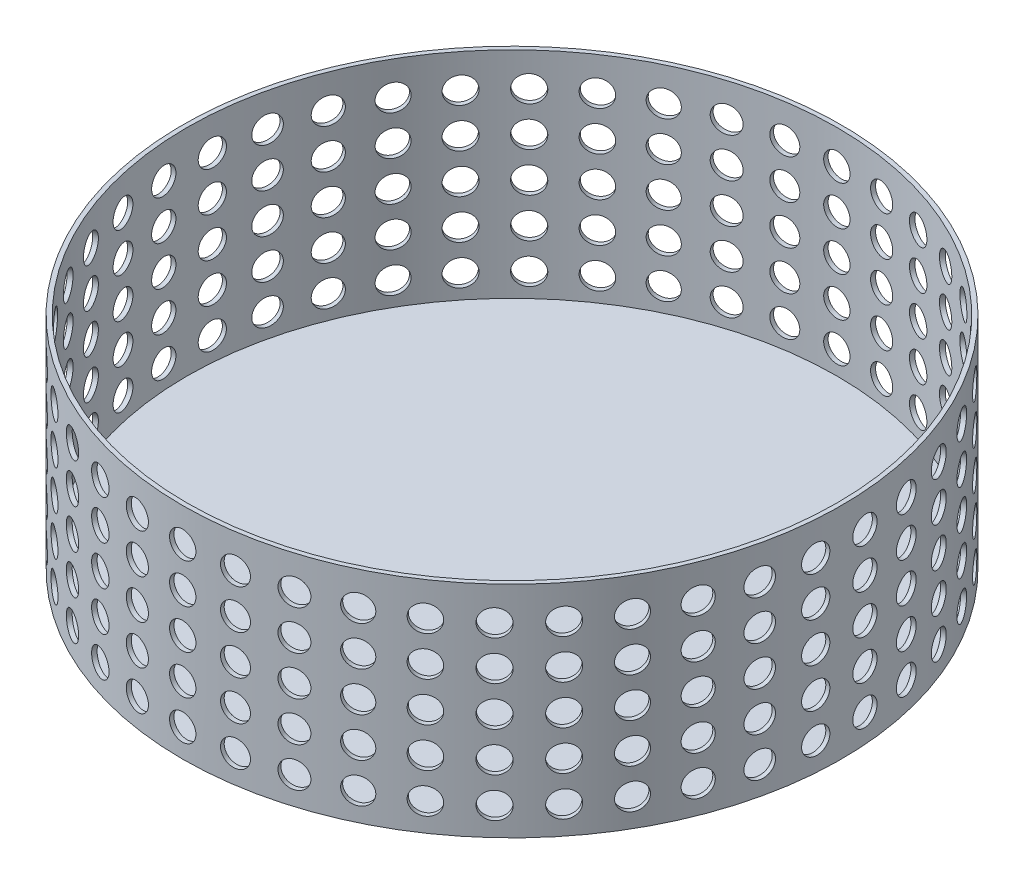
from build123d import *

# Parameters (mm, degrees)
SKETCH1_R           = 75
BOSS_EXTRUDE1_DEPTH = 50
SHELL1_T            = -1
SKETCH2_R           = 3
CUT_EXTRUDE1_DEPTH  = 118.260393996
CIRPATTERN1_COUNT   = 21


with BuildPart() as part:
    # Sketch1 → Boss-Extrude1 (new body)
    with BuildSketch(Plane(origin=(0, 0, 0), x_dir=(1, 0, 0), z_dir=(0, 1, 0))):
        with Locations(Location((0, 0, 0), (0, 0, 270))):
            Circle(SKETCH1_R)
    extrude(amount=BOSS_EXTRUDE1_DEPTH)

    # Shell1
    shell1_openings = [part.faces().sort_by_distance(p)[0] for p in [
        (0, 50, 0),
    ]]
    offset(amount=SHELL1_T, openings=shell1_openings, kind=Kind.INTERSECTION)

    # Sketch2 → Cut-Extrude1 (cut, symmetric)
    with BuildSketch(Plane.XY):
        with Locations((0, 6.347630084)):
            Circle(SKETCH2_R)
        with Locations((0, 15.347630084)):
            Circle(SKETCH2_R)
        with Locations((0, 24.347630084)):
            Circle(SKETCH2_R)
        with Locations((0, 33.347630084)):
            Circle(SKETCH2_R)
        with Locations((0, 42.347630084)):
            Circle(SKETCH2_R)
    cut_extrude1 = extrude(amount=CUT_EXTRUDE1_DEPTH, both=True, mode=Mode.SUBTRACT)

    # CirPattern1: Cut-Extrude1 ×21 about axis
    cirpattern1_axis = Axis((0, 50, 0), (0, -1, 0))
    for i in range(1, CIRPATTERN1_COUNT):
        add(cut_extrude1.rotate(cirpattern1_axis, i * 360 / CIRPATTERN1_COUNT), mode=Mode.SUBTRACT)


solid = part.part
